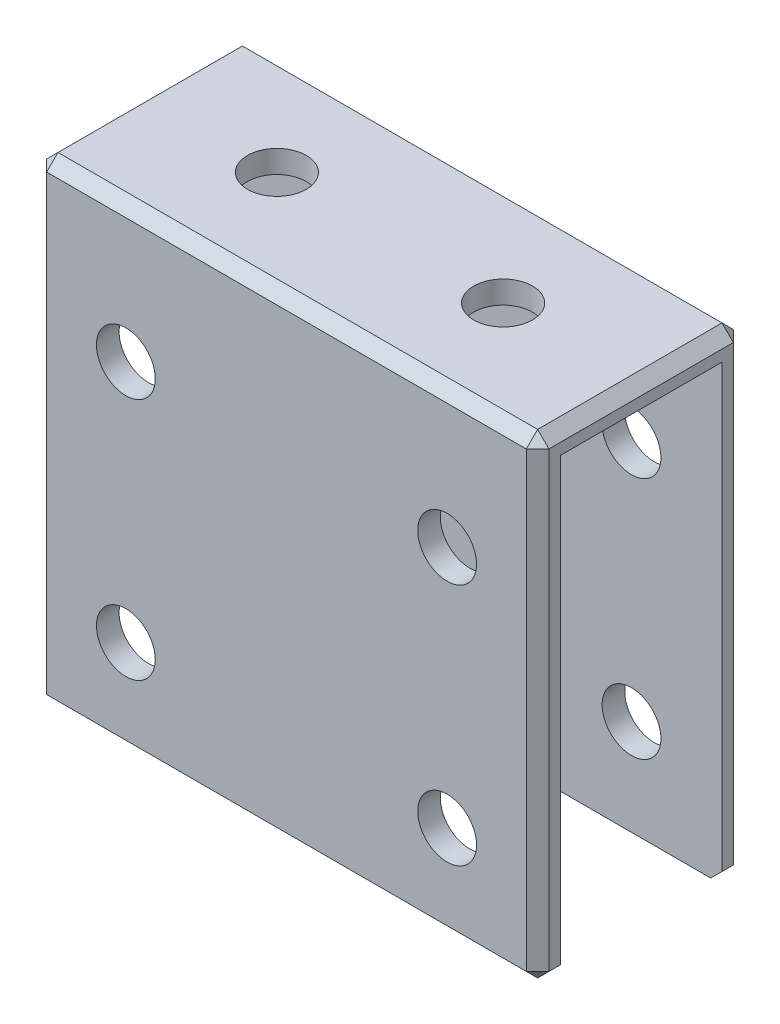
from build123d import *

# Parameters (mm, degrees)
SKETCH1_W           = 44.4
SKETCH1_H           = 40
SKETCH1_R           = 2.6
BOSS_EXTRUDE1_DEPTH = 2
SKETCH2_W           = 44.4
SKETCH2_H           = 18.3
BOSS_EXTRUDE2_DEPTH = 2
LPATTERN1_COUNT     = 2
LPATTERN1_PITCH     = 16.3
SKETCH3_R           = 2.6
CUT_EXTRUDE1_DEPTH  = 64.253853638
CHAMFER1_SIZE       = 1


with BuildPart() as part:
    # Sketch1 → Boss-Extrude1 (new body)
    with BuildSketch(Plane.XY):
        with Locations((22.2, 20)):
            Rectangle(SKETCH1_W, SKETCH1_H)
        with Locations((8, 8.476902454)):
            Circle(SKETCH1_R, mode=Mode.SUBTRACT)
        with Locations((8, 29.976902454)):
            Circle(SKETCH1_R, mode=Mode.SUBTRACT)
        with Locations((36.4, 29.976902454)):
            Circle(SKETCH1_R, mode=Mode.SUBTRACT)
        with Locations((36.4, 8.476902454)):
            Circle(SKETCH1_R, mode=Mode.SUBTRACT)
    boss_extrude1 = extrude(amount=BOSS_EXTRUDE1_DEPTH)

    # Sketch2 → Boss-Extrude2 (add)
    with BuildSketch(Plane(origin=(0, 40, 0), x_dir=(1, 0, 0), z_dir=(0, 1, 0))):
        with Locations((22.2, 7.15)):
            Rectangle(SKETCH2_W, SKETCH2_H)
    extrude(amount=BOSS_EXTRUDE2_DEPTH)

    # LPattern1: Boss-Extrude1 ×2
    with Locations(*[(0, 0, -i * LPATTERN1_PITCH) for i in range(1, LPATTERN1_COUNT)]):
        add(boss_extrude1)

    # Sketch3 → Cut-Extrude1 (cut, through all)
    with BuildSketch(Plane(origin=(0, 42, 0), x_dir=(1, 0, 0), z_dir=(0, 1, 0))):
        with Locations((12.2, 7.15)):
            Circle(SKETCH3_R)
        with Locations((32.2, 7.15)):
            Circle(SKETCH3_R)
    extrude(amount=-CUT_EXTRUDE1_DEPTH, mode=Mode.SUBTRACT)

    # Chamfer1
    chamfer1_edges = [part.edges().sort_by_distance(p)[0] for p in [
        (22.2, 42, -16.3),
        (0, 42, -7.15),
        (0, 21, -16.3),
        (22.2, 42, 2),
        (0, 21, 2),
        (0, 0, -15.3),
        (0, 0, 1),
        (22.2, 0, 2),
        (44.4, 0, 1),
        (44.4, 21, 2),
        (44.4, 42, -7.15),
        (44.4, 21, -16.3),
        (44.4, 0, -15.3),
        (22.2, 0, -16.3),
    ]]
    chamfer(chamfer1_edges, length=CHAMFER1_SIZE)


solid = part.part
